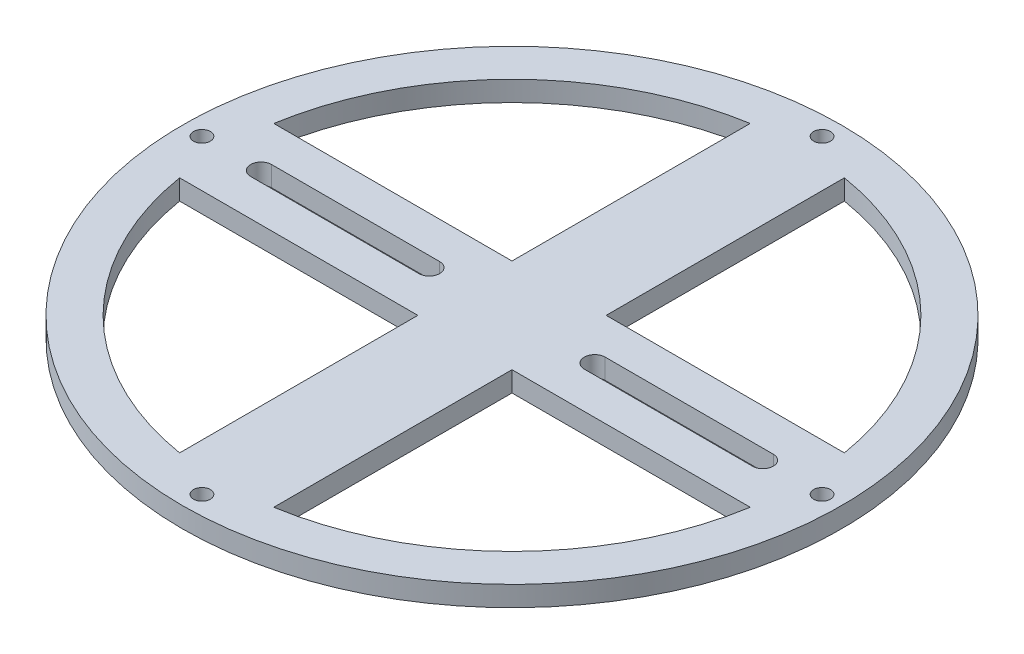
from build123d import *

# Parameters (mm, degrees)
SKETCH_1_R               = 49
EXTRUDE_1_DEPTH          = 3
CUT_EXTRUDE_3_DEPTH      = 70.361372535
CUT_EXTRUDE_4_DEPTH      = 70.361372535
PATTERN_CIRCULAR_4_COUNT = 2
SKETCH_2_R               = 1.25
CUT_EXTRUDE_5_DEPTH      = 70.361372535
PATTERN_CIRCULAR_5_COUNT = 4
PATTERN_CIRCULAR_6_COUNT = 4


with BuildPart() as part:
    # 草图1 → 凸台-拉伸1 (new body)
    with BuildSketch(Plane(origin=(0, 0, 0), x_dir=(1, 0, 0), z_dir=(0, 1, 0))):
        Circle(SKETCH_1_R)
    extrude(amount=EXTRUDE_1_DEPTH)

    # 草图5 → 切除-拉伸3 (cut, through all)
    with BuildSketch(Plane(origin=(0, 3, 0), x_dir=(1, 0, 0), z_dir=(0, 1, 0))):
        with BuildLine():
            Line((7, 42.420036355), (7, 7))
            Line((7, 7), (42.420036355, 7))
            ThreePointArc((42.420036355, 7), (30.401147054, 30.401147054), (7, 42.420036355))
        make_face()
    cut_extrude_3 = extrude(amount=-CUT_EXTRUDE_3_DEPTH, mode=Mode.SUBTRACT)

    # 草图6 → 切除-拉伸4 (cut, through all)
    with BuildSketch(Plane(origin=(0, 3, 0), x_dir=(1, 0, 0), z_dir=(0, 1, 0))):
        with BuildLine():
            Line((-12.3, -1.55), (-37.3, -1.55))
            ThreePointArc((-37.3, -1.55), (-38.85, 0), (-37.3, 1.55))
            Line((-37.3, 1.55), (-12.3, 1.55))
            ThreePointArc((-12.3, 1.55), (-10.75, 0), (-12.3, -1.55))
        make_face()
    cut_extrude_4 = extrude(amount=-CUT_EXTRUDE_4_DEPTH, mode=Mode.SUBTRACT)

    # 阵列(圆周)4: 切除-拉伸4 ×2 about axis
    pattern_circular_4_axis = Axis((0, 3, 0), (0, -1, 0))
    for i in range(1, PATTERN_CIRCULAR_4_COUNT):
        add(cut_extrude_4.rotate(pattern_circular_4_axis, i * 360 / PATTERN_CIRCULAR_4_COUNT), mode=Mode.SUBTRACT)

    # 草图2 → 切除-拉伸5 (cut, through all)
    with BuildSketch(Plane(origin=(0, 3, 0), x_dir=(1, 0, 0), z_dir=(0, 1, 0))):
        with Locations((0, 46.1)):
            Circle(SKETCH_2_R)
    cut_extrude_5 = extrude(amount=-CUT_EXTRUDE_5_DEPTH, mode=Mode.SUBTRACT)

    # 阵列(圆周)5: 切除-拉伸5 ×4 about axis
    pattern_circular_5_axis = Axis((0, 3, 0), (0, -1, 0))
    for i in range(1, PATTERN_CIRCULAR_5_COUNT):
        add(cut_extrude_5.rotate(pattern_circular_5_axis, i * 360 / PATTERN_CIRCULAR_5_COUNT), mode=Mode.SUBTRACT)

    # 阵列(圆周)6: 切除-拉伸3 ×4 about axis
    pattern_circular_6_axis = Axis((0, 3, 0), (0, -1, 0))
    for i in range(1, PATTERN_CIRCULAR_6_COUNT):
        add(cut_extrude_3.rotate(pattern_circular_6_axis, i * 360 / PATTERN_CIRCULAR_6_COUNT), mode=Mode.SUBTRACT)


solid = part.part
